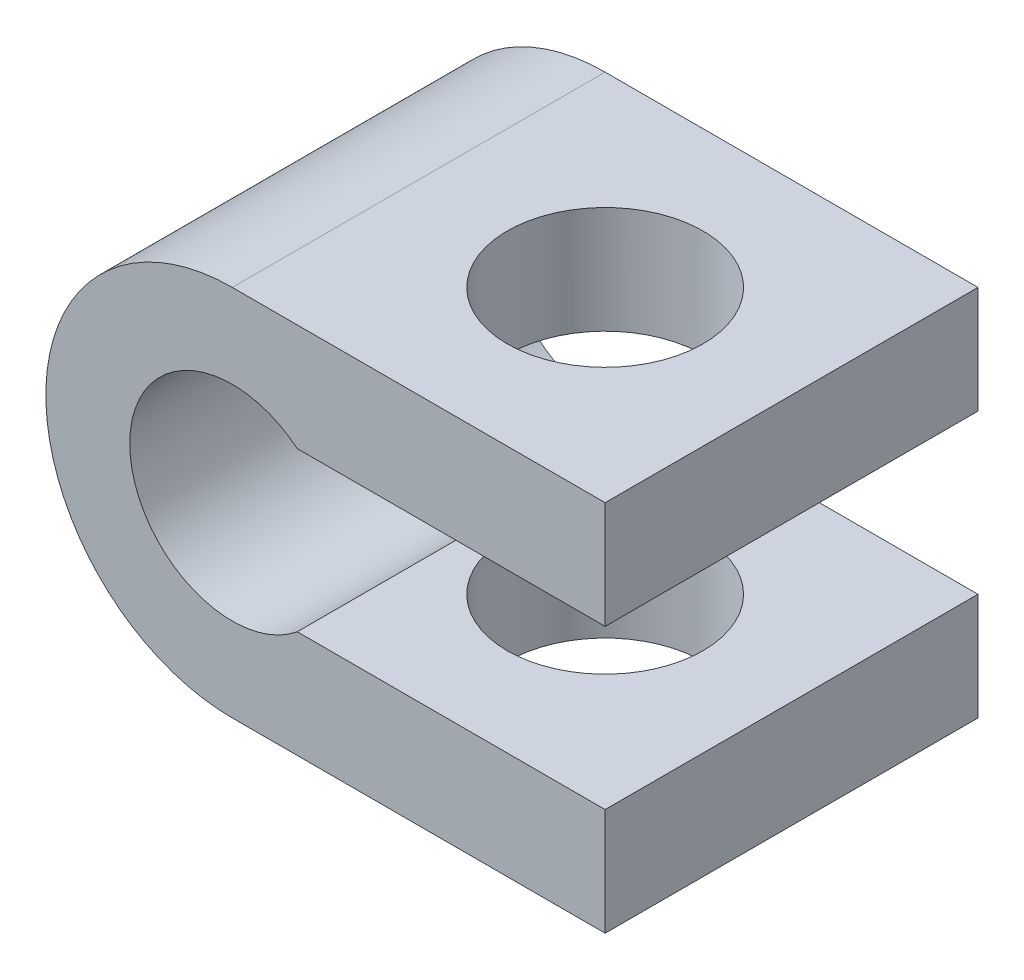
from build123d import *

# Parameters (mm, degrees)
BOSS_EXTRUDE1_DEPTH     = 12
CUT_EXTRUDE1_DEPTH      = 19
CUT_EXTRUDE1_DEPTH_BACK = 19
SKETCH2_R               = 3.15


with BuildPart() as part:
    # Sketch1 → Boss-Extrude1 (new body)
    with BuildSketch(Plane.XY):
        with BuildLine():
            Line((0, 6), (12, 6))
            Line((12, 6), (12, 2.552710574))
            Line((12, 2.552710574), (2.091331807, 2.552710574))
            ThreePointArc((2.091331807, 2.552710574), (-3.3, 0), (2.091331807, -2.552710574))
            Line((2.091331807, -2.552710574), (12, -2.552710574))
            Line((12, -2.552710574), (12, -6))
            Line((12, -6), (0, -6))
            ThreePointArc((0, -6), (-6, 0), (0, 6))
        make_face()
    extrude(amount=BOSS_EXTRUDE1_DEPTH)

    # Sketch2 → Cut-Extrude1 (cut, two sides: drawn at the far end of the back side and taken through both)
    with BuildSketch(Plane(origin=(0, 0, 0), x_dir=(1, 0, 0), z_dir=(0, 1, 0)).offset(-CUT_EXTRUDE1_DEPTH_BACK)):
        with Locations((6, -6)):
            Circle(SKETCH2_R)
    extrude(amount=CUT_EXTRUDE1_DEPTH + CUT_EXTRUDE1_DEPTH_BACK, mode=Mode.SUBTRACT)


solid = part.part
